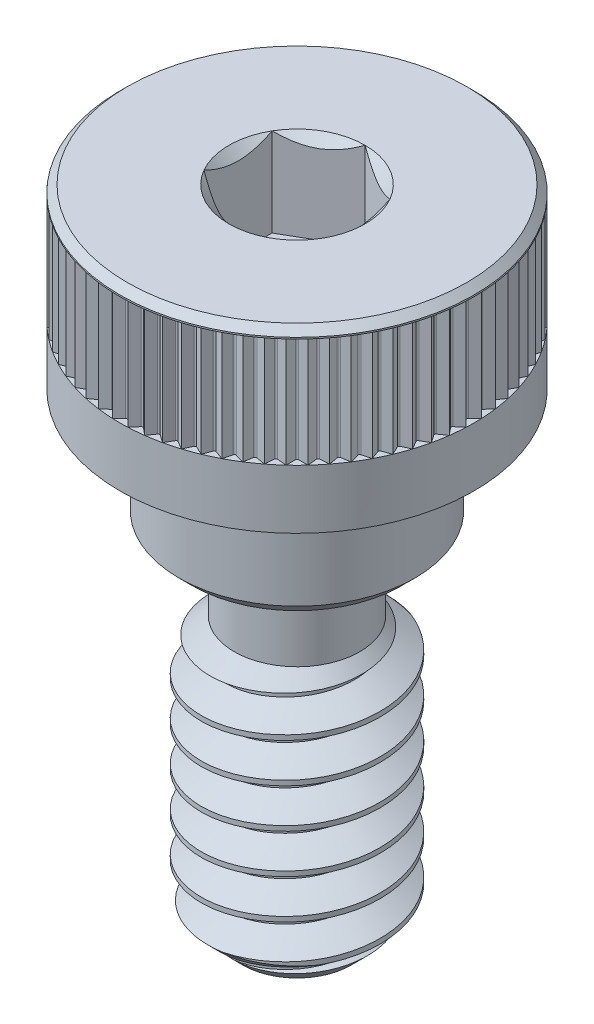
from build123d import *

# Parameters (mm, degrees)
SKETCH1_R          = 4.7625
EXTRUDE1_DEPTH     = 4.7625
CUT_EXTRUDE1_DEPTH = 2.38125
SKETCH4_R          = 3.175
EXTRUDE2_DEPTH     = 3.175
SKETCH5_R          = 2.413
EXTRUDE3_DEPTH     = 9.525
CHAMFER1_SIZE      = 0.9525
CUT_SWEEP1_PITCH   = 1.058333333
CUT_SWEEP1_TO      = 9.525
CUT_EXTRUDE3_DEPTH = 2.941919045
CHAMFER2_SIZE      = 0.194234129
CIRPATTERN2_COUNT  = 72
FILLET1_R          = 0.529166667
CHAMFER3_SIZE      = 0.352777778


with BuildPart() as part:
    # Sketch1 → Extrude1 (new body)
    with BuildSketch(Plane(origin=(0, 0, 0), x_dir=(1, 0, 0), z_dir=(0, 1, 0))):
        with Locations(Location((0, 0, 0), (0, 0, 90))):
            Circle(SKETCH1_R)
    extrude(amount=EXTRUDE1_DEPTH)

    # Sketch2 → Cut-Extrude1 (cut)
    with BuildSketch(Plane(origin=(0, 4.7625, 0), x_dir=(-1, 0, 0), z_dir=(0, 1, 0))):
        Polygon((0, -1.833087105), (1.5875, -0.916543552), (1.5875, 0.916543552), (0, 1.833087105), (-1.5875, 0.916543552), (-1.5875, -0.916543552), align=None)
    extrude(amount=-CUT_EXTRUDE1_DEPTH, mode=Mode.SUBTRACT)

    # Sketch4 → Extrude2 (add)
    with BuildSketch(Plane.XZ):
        with Locations(Location((0, 0, 0), (0, 0, 90))):
            Circle(SKETCH4_R)
    extrude(amount=EXTRUDE2_DEPTH)

    # Sketch5 → Extrude3 (add)
    with BuildSketch(Plane.XZ.offset(3.175)):
        with Locations(Location((0, 0, 0), (0, 0, 90))):
            Circle(SKETCH5_R)
    extrude(amount=EXTRUDE3_DEPTH)

    # Chamfer1
    chamfer1_edges = [part.edges().sort_by_distance(p)[0] for p in [
        (0, -12.7, -2.413),
    ]]
    chamfer(chamfer1_edges, length=CHAMFER1_SIZE)

    # Cut-Sweep1: arcs per turn and ends read off the stored shape
    # Cut-Sweep1: the profile of Sketch13 profile screwed along a right-hand helix through 11 turns, 6 arcs to a turn; built about Z, then put on its axis
    cut_sweep1_z = Axis((0, 0, 0), (0, 0, 1))
    cut_sweep1_corners = [(2.4133, 0, -0.132118462), (2.4133, 0, -1.058506538), (1.725592336, 0, -0.661458333), (1.725592336, 0, -0.529166667)]
    with BuildLine(mode=Mode.PRIVATE) as cut_sweep1_profile:
        Line(cut_sweep1_corners[0], cut_sweep1_corners[1])
        Line(cut_sweep1_corners[1], cut_sweep1_corners[2])
        Line(cut_sweep1_corners[2], cut_sweep1_corners[3])
        Line(cut_sweep1_corners[3], cut_sweep1_corners[0])
    cut_sweep1_cap = Face(cut_sweep1_profile.wire())
    cut_sweep1_turn_angles = [0, 30, 60, 90, 120, 150, 180, 210, 240, 270, 300, 330, 360]
    cut_sweep1_turn_weights = [1, 0.8660254037844387, 1, 0.8660254037844387, 1, 0.8660254037844387, 1, 0.8660254037844387, 1, 0.8660254037844387, 1, 0.8660254037844387, 1]
    cut_sweep1_turn_rails = [Edge.make_bspline([Vector(p[0], p[1], 0).rotate(cut_sweep1_z, cut_sweep1_turn_angles[k]) / cut_sweep1_turn_weights[k] + Vector(0, 0, p[2] + CUT_SWEEP1_PITCH * cut_sweep1_turn_angles[k] / 360) for k in range(13)], [0, 0, 0, 1, 1, 2, 2, 3, 3, 4, 4, 5, 5, 6, 6, 6], 2, cut_sweep1_turn_weights) for p in cut_sweep1_corners]
    cut_sweep1_turn_sides = [Face.make_surface_from_curves(cut_sweep1_turn_rails[p[0]], cut_sweep1_turn_rails[p[1]]) for p in [(0, 1), (1, 2), (2, 3), (3, 0)]]
    cut_sweep1 = Plane(origin=(0, -12.7, 0), x_dir=(0.7071067811865439, 0, 0.7071067811865512), z_dir=(0, 1, 0)) * split(Solid(Shell([*[p.moved(Location((0, 0, CUT_SWEEP1_PITCH * i))) for i in range(11) for p in cut_sweep1_turn_sides], cut_sweep1_cap, cut_sweep1_cap.rotate(cut_sweep1_z, 3960).moved(Location((0, 0, CUT_SWEEP1_PITCH * 3960 / 360)))])), bisect_by=Plane.XY.offset(CUT_SWEEP1_TO), keep=Keep.BOTTOM, mode=Mode.PRIVATE)
    add(cut_sweep1, mode=Mode.SUBTRACT)

    # Sketch18 → Cut-Revolve1 (revolve, cut)
    with BuildSketch(Plane.XY, mode=Mode.PRIVATE) as cut_revolve1_sk:
        Polygon((2.413, -3.175), (1.6891, -3.175), (1.6891, -5.2832), (2.413, -6.0071), align=None)
    revolve(cut_revolve1_sk.sketch.rotate(Axis((0, -3.175, 0), (0, 1, 0)), 90), axis=Axis((0, -3.175, 0), (0, 1, 0)), mode=Mode.SUBTRACT)

    # Sketch10 → Cut-Extrude3 (cut)
    with BuildSketch(Plane(origin=(0, 1.5875, 0), x_dir=(-1, 0, 0), z_dir=(0, 1, 0))):
        with BuildLine():
            Line((-4.757967155, -0.207737332), (-4.827695013, -0.210781716))
            Line((-4.827695013, -0.210781716), (-4.827695013, 0.210781716))
            Line((-4.827695013, 0.210781716), (-4.757967155, 0.207737332))
            Line((-4.757967155, 0.207737332), (-4.581019282, 0.030789459))
            ThreePointArc((-4.581019282, 0.030789459), (-4.568265871, 0), (-4.581019282, -0.030789459))
            Line((-4.581019282, -0.030789459), (-4.757967155, -0.207737332))
        make_face()
    cut_extrude3 = extrude(amount=CUT_EXTRUDE3_DEPTH, mode=Mode.SUBTRACT)

    # Chamfer2
    chamfer2_edges = [part.edges().sort_by_distance(p)[0] for p in [
        (0, 4.7625, 4.7625),
    ]]
    chamfer(chamfer2_edges, length=CHAMFER2_SIZE)

    # CirPattern2: Cut-Extrude3 ×72 about axis
    cirpattern2_axis = Axis((0, 0, 0), (0, 1, 0))
    for i in range(1, CIRPATTERN2_COUNT):
        add(cut_extrude3.rotate(cirpattern2_axis, i * 360 / CIRPATTERN2_COUNT), mode=Mode.SUBTRACT)

    # Fillet1
    fillet1_edges = [part.edges().sort_by_distance(p)[0] for p in [
        (0, -3.175, 1.6891),
    ]]
    fillet(fillet1_edges, radius=FILLET1_R)

    # Chamfer3
    chamfer3_edges = [part.edges().sort_by_distance(p)[0] for p in [
        (0, -3.175, -3.175),
    ]]
    chamfer(chamfer3_edges, length=CHAMFER3_SIZE)

    # Extrude4 cone 1 section (through the dimple's axis) → Extrude4 (revolve, cut)
    with BuildSketch(Plane(origin=(0, 4.7625, 0), x_dir=(0, 0, 1), z_dir=(1, 0, 0))):
        Polygon((0, 0), (1.833087105, 0), (0, 1.833087105), align=None)
    revolve(axis=Axis((0, 4.7625, 0), (0, -1, 0)), mode=Mode.SUBTRACT)


solid = part.part
